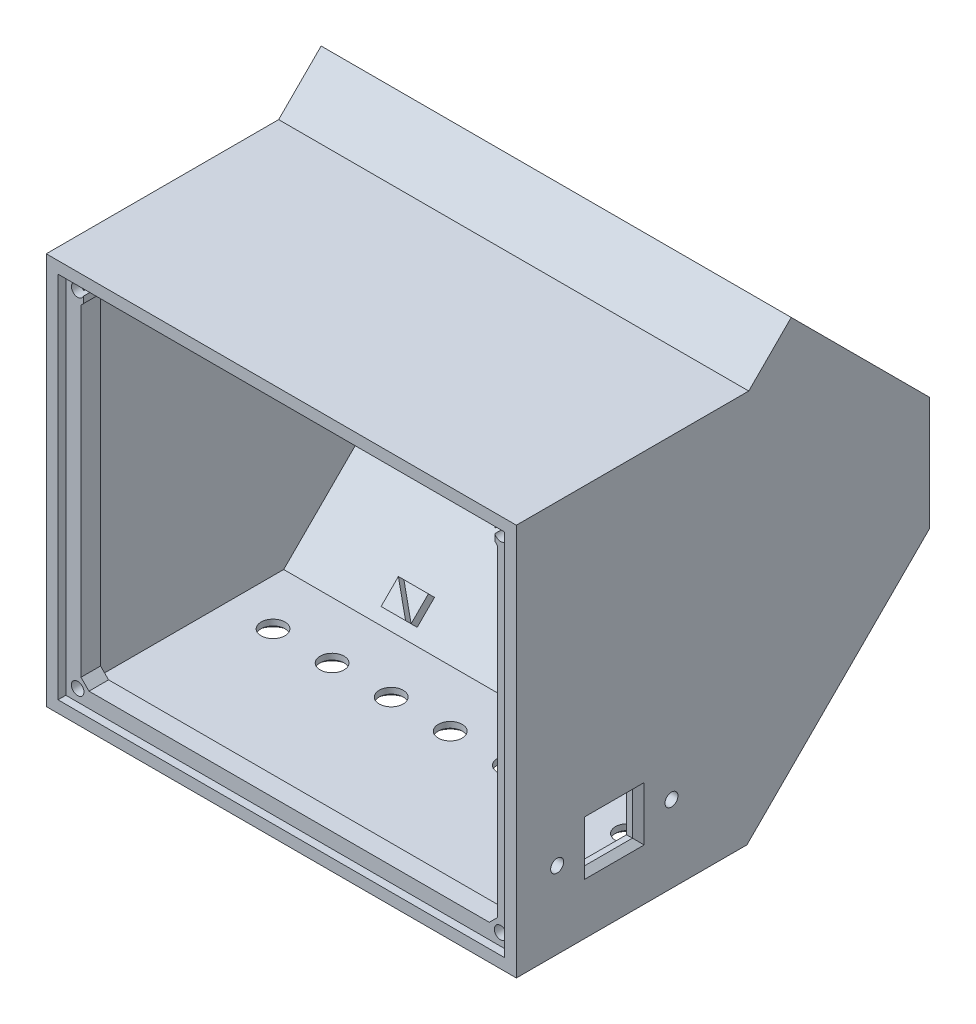
from build123d import *

# Parameters (mm, degrees)
BASEEXTRUDE_DEPTH        = 60
BASEEXTRUDE_DEPTH_BACK   = 60
SHELL2_T                 = -3
CONTROL_PANEL_W          = 110
CONTROL_PANEL_H          = 40
CUT_EXTRUDE1_DEPTH       = 10
CUT_EXTRUDE2_START       = 57
CUT_EXTRUDE2_OUTLINE_W   = 10.8
CUT_EXTRUDE2_OUTLINE_H   = 12.25
CUT_EXTRUDE2_OUTLINE_R   = 1.65
CUT_EXTRUDE2_DEPTH       = 3
REAR_PORTS_R             = 3.05
CUT_EXTRUDE3_DEPTH       = 3
REAR_PORTS_3_R           = 3.875
REAR_PORTS_3_R_2         = 3.05
CUT_EXTRUDE4_DEPTH       = 1.5
FILLET1_R                = 1.5
BOSS_EXTRUDE2_START      = 122.068760184
BOSS_EXTRUDE2_DEPTH      = 5
BOSS_EXTRUDE3_START      = 122.068760184
BOSS_EXTRUDE3_DEPTH      = 5
FILLET3_R                = 1.5
CUT_EXTRUDE6_START       = 122.068760184
CUT_EXTRUDE6_OUTLINE_R   = 1
CUT_EXTRUDE6_DEPTH       = 5
FILLET3_OF_MIRROR2_R     = 1.5
SKETCH17_W               = 90
SKETCH17_H               = 2
BOSS_EXTRUDE4_DEPTH      = 3.5
BOSS_EXTRUDE5_DEPTH      = 3.5
SKETCH19_W               = 90
SKETCH19_H               = 2
BOSS_EXTRUDE6_DEPTH      = 3.5
CONVERTOR_IN_PLACE_R     = 3.175
BOSS_EXTRUDE8_DEPTH      = 7.2
BOSS_EXTRUDE9_DEPTH      = 7.2
CONVERTOR_IN_PLACE_5_R   = 4.501396483
CONVERTOR_IN_PLACE_5_R_2 = 3.175
BOSS_EXTRUDE11_DEPTH     = 5.2
CUT_EXTRUDE7_START       = -2
CONVERTOR_IN_PLACE_7_R   = 1.7
CUT_EXTRUDE7_DEPTH       = 5.2
CHAMFER1_SIZE            = 1.5
BOSS_EXTRUDE12_START     = -7
BOSS_EXTRUDE12_OUTLINE_W = 114
BOSS_EXTRUDE12_OUTLINE_H = 94.101945435
BOSS_EXTRUDE12_OUTLINE_R = 1.6
BOSS_EXTRUDE12_DEPTH     = 5


# Read off the part's stored shape, not the designer's step: Cut-Extrude2, Boss-Extrude2, Boss-Extrude3, Cut-Extrude6, Boss-Extrude12
with BuildPart() as part:
    # Silhouoette → BaseExtrude (new, two sides: drawn at the far end of the back side and taken through both)
    with BuildSketch(Plane(origin=(0, 0, 0), x_dir=(0, 0, -1), z_dir=(1, 0, 0)).offset(-BASEEXTRUDE_DEPTH_BACK)):
        Polygon((59.318338504, 100.101945435), (0, 100.101945435), (0, 0), (58.852776819, 0), (105.521824378, 46.669047558), (105.521824378, 75.59475319), (70.166485318, 110.950092249), align=None)
    extrude(amount=BASEEXTRUDE_DEPTH + BASEEXTRUDE_DEPTH_BACK)

    # Shell2
    shell2_openings = [part.faces().sort_by_distance(p)[0] for p in [
        (0, 50.050972717, 0),
    ]]
    offset(amount=SHELL2_T, openings=shell2_openings, kind=Kind.INTERSECTION)

    # Control Panel → Cut-Extrude1 (cut)
    with BuildSketch(Plane(origin=(0, 90.558288784, -90.558288784), x_dir=(-1, 0, 0), z_dir=(0, -0.7071067811865477, 0.7071067811865474))):
        with Locations((0, -3.838365022)):
            Rectangle(CONTROL_PANEL_W, CONTROL_PANEL_H)
    extrude(amount=CUT_EXTRUDE1_DEPTH, mode=Mode.SUBTRACT)

    # Cut-Extrude2 outline → Cut-Extrude2 (cut)
    with BuildSketch(Plane.YZ.offset(CUT_EXTRUDE2_START)):
        with Locations((20, -25)):
            Rectangle(CUT_EXTRUDE2_OUTLINE_W, CUT_EXTRUDE2_OUTLINE_H)
        with Locations((19.651957534, -39.6)):
            Circle(CUT_EXTRUDE2_OUTLINE_R)
        with Locations((19.651957534, -10.4)):
            Circle(CUT_EXTRUDE2_OUTLINE_R)
    extrude(amount=CUT_EXTRUDE2_DEPTH, mode=Mode.SUBTRACT)

    # Rear Ports → Cut-Extrude3 (cut)
    with BuildSketch(Plane(origin=(0, 0, 0), x_dir=(1, 0, 0), z_dir=(0, 1, 0))):
        with Locations(Location((45.232527778, 43.12294032, 0), (0, 0, 90))):
            Circle(REAR_PORTS_R)
        with Locations(Location((30.155018519, 43.12294032, 0), (0, 0, 90))):
            Circle(REAR_PORTS_R)
        with Locations(Location((15.077509259, 43.12294032, 0), (0, 0, 90))):
            Circle(REAR_PORTS_R)
        with Locations(Location((-15.077509259, 43.12294032, 0), (0, 0, 90))):
            Circle(REAR_PORTS_R)
        with Locations(Location((-30.155018519, 43.12294032, 0), (0, 0, 90))):
            Circle(REAR_PORTS_R)
        with Locations(Location((-45.232527778, 43.12294032, 0), (0, 0, 90))):
            Circle(REAR_PORTS_R)
        with Locations(Location((0, 43.12294032, 0), (0, 0, 90))):
            Circle(REAR_PORTS_R)
    extrude(amount=CUT_EXTRUDE3_DEPTH, mode=Mode.SUBTRACT)

    # Rear Ports<3> → Cut-Extrude4 (cut)
    # profile 1 of 7: a face of its own
    with BuildSketch(Plane(origin=(0, 0, 0), x_dir=(1, 0, 0), z_dir=(0, 1, 0))):
        with Locations(Location((45.232527778, 43.12294032, 0), (0, 0, 90))):
            Circle(REAR_PORTS_3_R)
        with Locations(Location((45.232527778, 43.12294032, 0), (0, 0, 90))):
            Circle(REAR_PORTS_3_R_2, mode=Mode.SUBTRACT)
    # profile 2 of 7: a face of its own
    with BuildSketch(Plane(origin=(0, 0, 0), x_dir=(1, 0, 0), z_dir=(0, 1, 0))):
        with Locations(Location((30.155018519, 43.12294032, 0), (0, 0, 90))):
            Circle(REAR_PORTS_3_R)
        with Locations(Location((30.155018519, 43.12294032, 0), (0, 0, 90))):
            Circle(REAR_PORTS_3_R_2, mode=Mode.SUBTRACT)
    # profile 3 of 7: a face of its own
    with BuildSketch(Plane(origin=(0, 0, 0), x_dir=(1, 0, 0), z_dir=(0, 1, 0))):
        with Locations(Location((15.077509259, 43.12294032, 0), (0, 0, 90))):
            Circle(REAR_PORTS_3_R)
        with Locations(Location((15.077509259, 43.12294032, 0), (0, 0, 90))):
            Circle(REAR_PORTS_3_R_2, mode=Mode.SUBTRACT)
    # profile 4 of 7: a face of its own
    with BuildSketch(Plane(origin=(0, 0, 0), x_dir=(1, 0, 0), z_dir=(0, 1, 0))):
        with Locations(Location((-15.077509259, 43.12294032, 0), (0, 0, 90))):
            Circle(REAR_PORTS_3_R)
        with Locations(Location((-15.077509259, 43.12294032, 0), (0, 0, 90))):
            Circle(REAR_PORTS_3_R_2, mode=Mode.SUBTRACT)
    # profile 5 of 7: a face of its own
    with BuildSketch(Plane(origin=(0, 0, 0), x_dir=(1, 0, 0), z_dir=(0, 1, 0))):
        with Locations(Location((-30.155018519, 43.12294032, 0), (0, 0, 90))):
            Circle(REAR_PORTS_3_R)
        with Locations(Location((-30.155018519, 43.12294032, 0), (0, 0, 90))):
            Circle(REAR_PORTS_3_R_2, mode=Mode.SUBTRACT)
    # profile 6 of 7: a face of its own
    with BuildSketch(Plane(origin=(0, 0, 0), x_dir=(1, 0, 0), z_dir=(0, 1, 0))):
        with Locations(Location((-45.232527778, 43.12294032, 0), (0, 0, 90))):
            Circle(REAR_PORTS_3_R)
        with Locations(Location((-45.232527778, 43.12294032, 0), (0, 0, 90))):
            Circle(REAR_PORTS_3_R_2, mode=Mode.SUBTRACT)
    # profile 7 of 7: a face of its own
    with BuildSketch(Plane(origin=(0, 0, 0), x_dir=(1, 0, 0), z_dir=(0, 1, 0))):
        with Locations(Location((0, 43.12294032, 0), (0, 0, 90))):
            Circle(REAR_PORTS_3_R)
    extrude(amount=CUT_EXTRUDE4_DEPTH, mode=Mode.SUBTRACT)

    # Fillet1
    fillet1_edges = [part.edges().sort_by_distance(p)[0] for p in [
        (45.232527778, 0, -39.24794032),
        (0, 0, -39.24794032),
        (-45.232527778, 0, -39.24794032),
        (-30.155018519, 0, -39.24794032),
        (-15.077509259, 0, -39.24794032),
        (15.077509259, 0, -39.24794032),
        (30.155018519, 0, -39.24794032),
    ]]
    fillet(fillet1_edges, radius=FILLET1_R - 0.0001)  # a hair under: the kernel refuses the full size

    # Boss-Extrude2 outline → Boss-Extrude2 (add)
    with BuildSketch(Plane(origin=(0, 0, 0), x_dir=(1, 0, 0), z_dir=(0, 0.707106781186548, -0.707106781186547)).offset(BOSS_EXTRUDE2_START)):
        with BuildLine():
            ThreePointArc((-50, 6.161634978), (-46.464466094, 7.626101072), (-45, 11.161634978))
            Line((-45, 11.161634978), (-45, 21.161634978))
            Line((-45, 21.161634978), (-57, 21.161634978))
            Line((-57, 21.161634978), (-57, 6.161634978))
            Line((-57, 6.161634978), (-50, 6.161634978))
        make_face()
    boss_extrude2 = extrude(amount=BOSS_EXTRUDE2_DEPTH)

    # Boss-Extrude3 outline → Boss-Extrude3 (add)
    with BuildSketch(Plane(origin=(0, 0, 0), x_dir=(1, 0, 0), z_dir=(0, 0.707106781186548, -0.707106781186547)).offset(BOSS_EXTRUDE3_START)):
        with BuildLine():
            ThreePointArc((-45, -18.838365022), (-46.464466094, -15.302831116), (-50, -13.838365022))
            Line((-50, -13.838365022), (-57, -13.838365022))
            Line((-57, -13.838365022), (-57, -25.838365022))
            Line((-57, -25.838365022), (-45, -25.838365022))
            Line((-45, -25.838365022), (-45, -18.838365022))
        make_face()
    boss_extrude3 = extrude(amount=BOSS_EXTRUDE3_DEPTH)

    # Fillet3
    fillet3_edges = [part.edges().sort_by_distance(p)[0] for p in [
        (-46.464466094, 80.923180315, -91.708115879),
        (-53.5, 81.958714221, -90.672581973),
        (-45, 74.887646409, -97.743649785),
        (-53.5, 96.100849845, -76.53044635),
        (-45, 102.111257485, -70.520038709),
        (-46.464466094, 97.136383751, -75.494912444),
    ]]
    fillet(fillet3_edges, radius=FILLET3_R)

    # Cut-Extrude6 outline → Cut-Extrude6 (cut)
    with BuildSketch(Plane(origin=(0, 0, 0), x_dir=(1, 0, 0), z_dir=(0, 0.707106781186548, -0.707106781186547)).offset(CUT_EXTRUDE6_START)):
        with Locations((-50, -18.838365022)):
            Circle(CUT_EXTRUDE6_OUTLINE_R)
        with Locations((-50, 11.161634978)):
            Circle(CUT_EXTRUDE6_OUTLINE_R)
    cut_extrude6 = extrude(amount=CUT_EXTRUDE6_DEPTH, mode=Mode.SUBTRACT)

    # Mirror2: Boss-Extrude2, Boss-Extrude3, Cut-Extrude6 across plane
    add(boss_extrude2.mirror(Plane(origin=(0, 0, 0), x_dir=(0, 0, 1), z_dir=(1, 0, 0))))
    add(boss_extrude3.mirror(Plane(origin=(0, 0, 0), x_dir=(0, 0, 1), z_dir=(1, 0, 0))))
    add(cut_extrude6.mirror(Plane(origin=(0, 0, 0), x_dir=(0, 0, 1), z_dir=(1, 0, 0))), mode=Mode.SUBTRACT)

    # Fillet3 of Mirror2
    fillet3_of_mirror2_edges = [part.edges().sort_by_distance(p)[0] for p in [
        (46.464466094, 80.923180315, -91.708115879),
        (53.5, 81.958714221, -90.672581973),
        (45, 74.887646409, -97.743649785),
        (53.5, 96.100849845, -76.53044635),
        (45, 102.111257485, -70.520038709),
        (46.464466094, 97.136383751, -75.494912444),
    ]]
    fillet(fillet3_of_mirror2_edges, radius=FILLET3_OF_MIRROR2_R)

    # Sketch17 → Boss-Extrude4 (add)
    with BuildSketch(Plane(origin=(0, -11.428001688, -11.428001688), x_dir=(1, 0, 0), z_dir=(0, 0.7071067811865474, 0.7071067811865477))):
        with Locations((0, 126.068760184)):
            Rectangle(SKETCH17_W, SKETCH17_H)
    extrude(amount=BOSS_EXTRUDE4_DEPTH)

    # Sketch18 → Boss-Extrude5 (add)
    with BuildSketch(Plane(origin=(-55, 0, 0), x_dir=(0, 0, -1), z_dir=(1, 0, 0))):
        Polygon((94.208115879, 85.494248127), (80.065980255, 99.63638375), (78.651766693, 98.222170188), (92.793902316, 84.080034564), align=None)
    boss_extrude5 = extrude(amount=BOSS_EXTRUDE5_DEPTH)

    # Sketch19 → Boss-Extrude6 (add)
    with BuildSketch(Plane(origin=(0, 16.85626956, 16.85626956), x_dir=(1, 0, 0), z_dir=(0, -0.7071067811865474, -0.7071067811865477))):
        with Locations((0, -126.068760184)):
            Rectangle(SKETCH19_W, SKETCH19_H)
    extrude(amount=BOSS_EXTRUDE6_DEPTH)

    # Mirror3: Boss-Extrude5 across plane
    add(boss_extrude5.mirror(Plane(origin=(0, 0, 0), x_dir=(0, 0, 1), z_dir=(1, 0, 0))))

    # Convertor in place → Boss-Extrude8 (add)
    with BuildSketch(Plane(origin=(0, -29.42638841, -29.42638841), x_dir=(-1, 0, 0), z_dir=(-3.4914813388431334e-15, -0.7071067811865462, -0.7071067811865488))):
        with Locations(Location((-26.6, 74.615197581, 0), (0, 0, 90))):
            Circle(CONVERTOR_IN_PLACE_R)
        with Locations(Location((26.6, 74.615197581, 0), (0, 0, 90))):
            Circle(CONVERTOR_IN_PLACE_R)
    extrude(amount=-BOSS_EXTRUDE8_DEPTH)

    # Convertor in place<4> → Boss-Extrude9 (add)
    with BuildSketch(Plane(origin=(0, -29.42638841, -29.42638841), x_dir=(-1, 0, 0), z_dir=(-3.4914813388431334e-15, -0.7071067811865462, -0.7071067811865488))):
        Polygon((31.3, 52.115197581), (25.05, 45.865197581), (31.3, 45.865197581), align=None)
        Polygon((-25.95, 45.865197581), (-32.2, 52.115197581), (-32.2, 45.865197581), align=None)
        Polygon((-25.95, 103.365197581), (-32.2, 103.365197581), (-32.2, 97.115197581), align=None)
        Polygon((31.3, 103.365197581), (25.05, 103.365197581), (31.3, 97.115197581), align=None)
    extrude(amount=-BOSS_EXTRUDE9_DEPTH)

    # Convertor in place<5> → Boss-Extrude11 (add)
    # profile 1 of 6: a face of its own
    with BuildSketch(Plane(origin=(0, -29.42638841, -29.42638841), x_dir=(-1, 0, 0), z_dir=(-3.4914813388431334e-15, -0.7071067811865462, -0.7071067811865488))):
        Polygon((31.3, 52.115197581), (25.05, 45.865197581), (25.05, 52.115197581), align=None)
    # profile 2 of 6: a face of its own
    with BuildSketch(Plane(origin=(0, -29.42638841, -29.42638841), x_dir=(-1, 0, 0), z_dir=(-3.4914813388431334e-15, -0.7071067811865462, -0.7071067811865488))):
        Polygon((-25.95, 45.865197581), (-25.95, 52.115197581), (-32.2, 52.115197581), align=None)
    # profile 3 of 6: a face of its own
    with BuildSketch(Plane(origin=(0, -29.42638841, -29.42638841), x_dir=(-1, 0, 0), z_dir=(-3.4914813388431334e-15, -0.7071067811865462, -0.7071067811865488))):
        Polygon((-32.2, 97.115197581), (-25.95, 97.115197581), (-25.95, 103.365197581), align=None)
    # profile 4 of 6: a face of its own
    with BuildSketch(Plane(origin=(0, -29.42638841, -29.42638841), x_dir=(-1, 0, 0), z_dir=(-3.4914813388431334e-15, -0.7071067811865462, -0.7071067811865488))):
        with Locations(Location((26.6, 74.615197581, 0), (0, 0, 90))):
            Circle(CONVERTOR_IN_PLACE_5_R)
        with Locations(Location((26.6, 74.615197581, 0), (0, 0, 90))):
            Circle(CONVERTOR_IN_PLACE_5_R_2, mode=Mode.SUBTRACT)
    # profile 5 of 6: a face of its own
    with BuildSketch(Plane(origin=(0, -29.42638841, -29.42638841), x_dir=(-1, 0, 0), z_dir=(-3.4914813388431334e-15, -0.7071067811865462, -0.7071067811865488))):
        with Locations(Location((-26.6, 74.615197581, 0), (0, 0, 90))):
            Circle(CONVERTOR_IN_PLACE_5_R)
        with Locations(Location((-26.6, 74.615197581, 0), (0, 0, 90))):
            Circle(CONVERTOR_IN_PLACE_5_R_2, mode=Mode.SUBTRACT)
    # profile 6 of 6: a face of its own
    with BuildSketch(Plane(origin=(0, -29.42638841, -29.42638841), x_dir=(-1, 0, 0), z_dir=(-3.4914813388431334e-15, -0.7071067811865462, -0.7071067811865488))):
        Polygon((31.3, 97.115197581), (25.05, 97.115197581), (25.05, 103.365197581), align=None)
    extrude(amount=-BOSS_EXTRUDE11_DEPTH)

    # Convertor in place<7> → Cut-Extrude7 (cut)
    with BuildSketch(Plane(origin=(0, -29.42638841, -29.42638841), x_dir=(-1, 0, 0), z_dir=(-3.4914813388431334e-15, -0.7071067811865462, -0.7071067811865488)).offset(CUT_EXTRUDE7_START)):
        with Locations(Location((26.6, 74.615197581, 0), (0, 0, 90))):
            Circle(CONVERTOR_IN_PLACE_7_R)
        with Locations(Location((-26.6, 74.615197581, 0), (0, 0, 90))):
            Circle(CONVERTOR_IN_PLACE_7_R)
    extrude(amount=-CUT_EXTRUDE7_DEPTH, mode=Mode.SUBTRACT)

    # Chamfer1
    chamfer1_edges = [part.edges().sort_by_distance(p)[0] for p in [
        (60, 14.6, -25),
        (60, 20, -31.125),
        (60, 25.4, -25),
        (60, 20, -18.875),
    ]]
    chamfer(chamfer1_edges, length=CHAMFER1_SIZE)

    # Boss-Extrude12 outline → Boss-Extrude12 (add)
    with BuildSketch(Plane.XY.offset(BOSS_EXTRUDE12_START)):
        with Locations((0, 50.050972718)):
            Rectangle(BOSS_EXTRUDE12_OUTLINE_W, BOSS_EXTRUDE12_OUTLINE_H)
        with Locations((-53.982183069, 6.017816931)):
            Circle(BOSS_EXTRUDE12_OUTLINE_R, mode=Mode.SUBTRACT)
        with Locations((53.982183069, 6.017816931)):
            Circle(BOSS_EXTRUDE12_OUTLINE_R, mode=Mode.SUBTRACT)
        with BuildLine():
            Line((51.091459719, 6.863303695), (-51.091459719, 6.863303695))
            Line((-51.091459719, 6.863303695), (-53.136696305, 8.908540281))
            Line((-53.136696305, 8.908540281), (-53.136696305, 91.193405154))
            Line((-53.136696305, 91.193405154), (-52.5, 91.830101459))
            Line((-52.5, 91.830101459), (-52.5, 93.481523035))
            ThreePointArc((-52.5, 93.481523035), (-55.582183069, 94.084128503), (-52.5, 94.686733972))
            Line((-52.5, 94.686733972), (-52.5, 95.902780174))
            Line((-52.5, 95.902780174), (52.5, 95.902780174))
            Line((52.5, 95.902780174), (52.5, 94.686733972))
            ThreePointArc((52.5, 94.686733972), (55.582183069, 94.084128503), (52.5, 93.481523035))
            Line((52.5, 93.481523035), (52.5, 91.830101459))
            Line((52.5, 91.830101459), (53.136696305, 91.193405154))
            Line((53.136696305, 91.193405154), (53.136696305, 8.908540281))
            Line((53.136696305, 8.908540281), (51.091459719, 6.863303695))
        make_face(mode=Mode.SUBTRACT)
    extrude(amount=BOSS_EXTRUDE12_DEPTH)


solid = part.part
